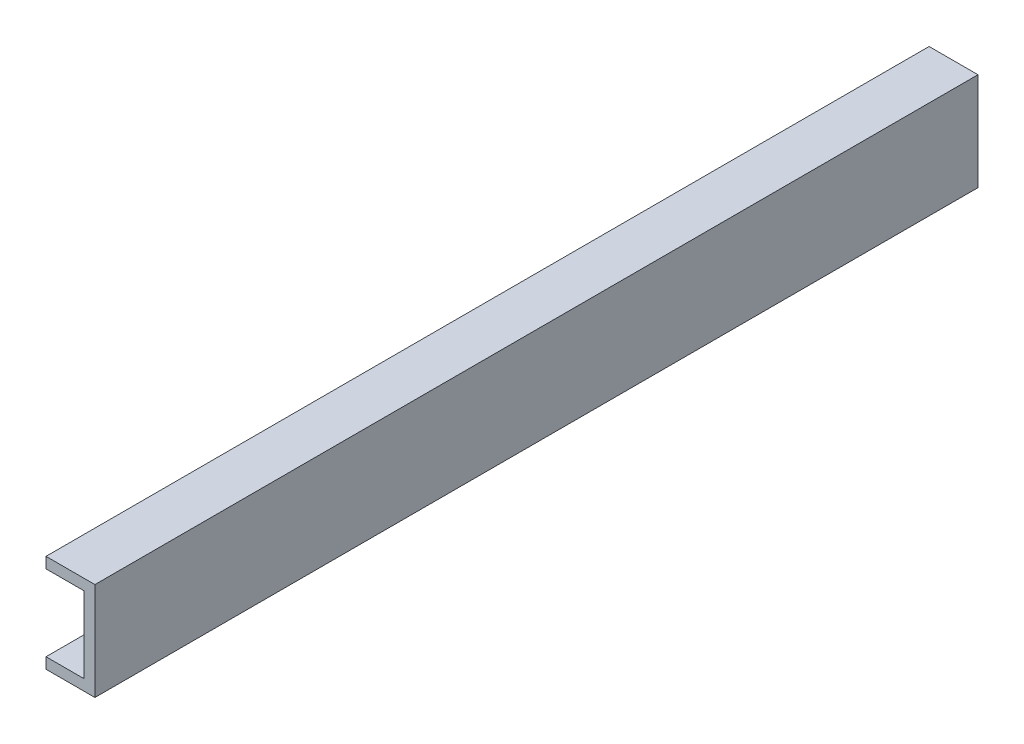
from build123d import *

# Parameters (mm, degrees)
BOSS_EXTRUDE1_DEPTH = 162.5


with BuildPart() as part:
    # Sketch1 → Boss-Extrude1 (new body)
    with BuildSketch(Plane.XY):
        Polygon((-9, 9.888282785), (0, 9.888282785), (0, -8.111717215), (-9, -8.111717215), (-9, -6.111717215), (-2, -6.111717215), (-2, 7.888282785), (-9, 7.888282785), align=None)
    extrude(amount=-BOSS_EXTRUDE1_DEPTH)


solid = part.part
